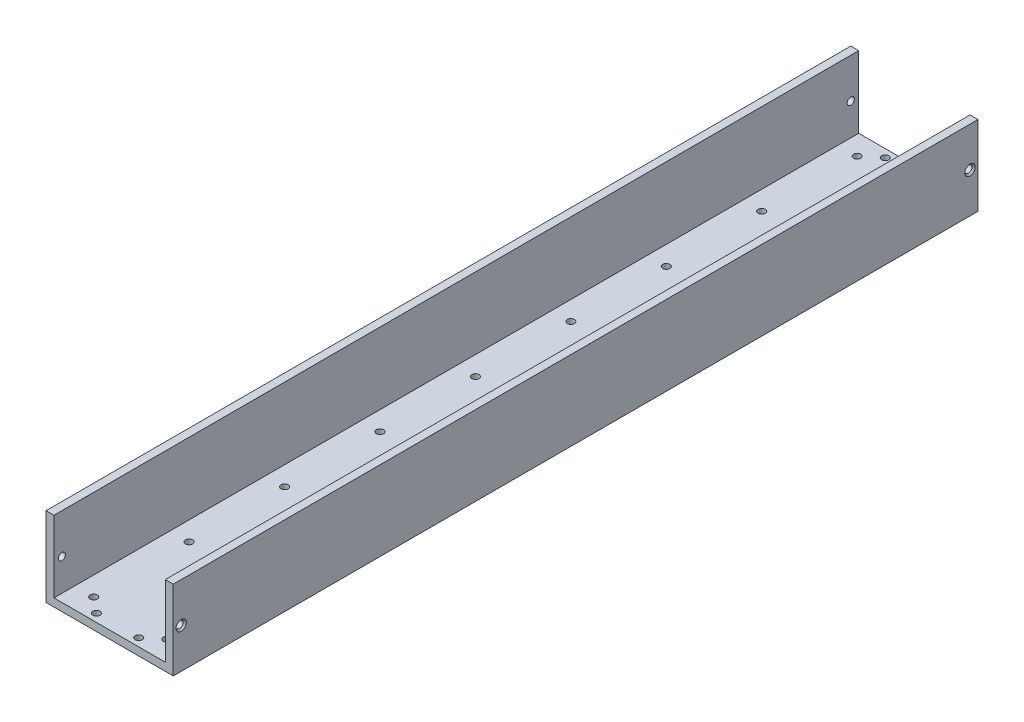
from build123d import *

# Parameters (mm, degrees)
ESTRUSIONE_ESTRUSIONE1_DEPTH = 506
SCHIZZO3_R                   = 2.25
TAGLIO_ESTRUSIONE1_DEPTH     = 515.719341001
SMUSSO1_SIZE                 = 1
SCHIZZO4_R                   = 2.25
TAGLIO_ESTRUSIONE2_DEPTH     = 515.719341001
SCHIZZO5_R                   = 2.25
TAGLIO_ESTRUSIONE3_DEPTH     = 515.719341001
SMUSSO2_SIZE                 = 1


with BuildPart() as part:
    # Schizzo1 → Estrusione-Estrusione1 (new body)
    with BuildSketch(Plane.XY):
        Polygon((75, 5), (75, 50), (80, 50), (80, 0), (0, 0), (0, 50), (5, 50), (5, 5), align=None)
    extrude(amount=-ESTRUSIONE_ESTRUSIONE1_DEPTH)

    # Schizzo3 → Taglio-Estrusione1 (cut, through all)
    with BuildSketch(Plane(origin=(80, 0, 0), x_dir=(0, 0, -1), z_dir=(1, 0, 0))):
        with Locations((5, 25)):
            Circle(SCHIZZO3_R)
        with Locations((501, 25)):
            Circle(SCHIZZO3_R)
    extrude(amount=-TAGLIO_ESTRUSIONE1_DEPTH, mode=Mode.SUBTRACT)

    # Smusso1
    smusso1_edges = [part.edges().sort_by_distance(p)[0] for p in [
        (0, 25, -498.75),
        (0, 25, -2.75),
        (80, 25, -498.75),
        (80, 25, -2.75),
    ]]
    chamfer(smusso1_edges, length=SMUSSO1_SIZE)

    # Schizzo4 → Taglio-Estrusione2 (cut, through all)
    with BuildSketch(Plane.XZ):
        with Locations((63, -253)):
            Circle(SCHIZZO4_R)
        with Locations((63, -193)):
            Circle(SCHIZZO4_R)
        with Locations((63, -133)):
            Circle(SCHIZZO4_R)
        with Locations((63, -73)):
            Circle(SCHIZZO4_R)
        with Locations((63, -13)):
            Circle(SCHIZZO4_R)
        with Locations((63, -493)):
            Circle(SCHIZZO4_R)
        with Locations((63, -433)):
            Circle(SCHIZZO4_R)
        with Locations((63, -373)):
            Circle(SCHIZZO4_R)
        with Locations((63, -313)):
            Circle(SCHIZZO4_R)
        with Locations((17, -313)):
            Circle(SCHIZZO4_R)
        with Locations((17, -373)):
            Circle(SCHIZZO4_R)
        with Locations((17, -433)):
            Circle(SCHIZZO4_R)
        with Locations((17, -493)):
            Circle(SCHIZZO4_R)
        with Locations((17, -13)):
            Circle(SCHIZZO4_R)
        with Locations((17, -73)):
            Circle(SCHIZZO4_R)
        with Locations((17, -133)):
            Circle(SCHIZZO4_R)
        with Locations((17, -193)):
            Circle(SCHIZZO4_R)
        with Locations((17, -253)):
            Circle(SCHIZZO4_R)
    extrude(amount=-TAGLIO_ESTRUSIONE2_DEPTH, mode=Mode.SUBTRACT)

    # Schizzo5 → Taglio-Estrusione3 (cut, through all)
    with BuildSketch(Plane.XZ):
        with Locations((26.7, -5)):
            Circle(SCHIZZO5_R)
        with Locations((53.3, -5)):
            Circle(SCHIZZO5_R)
        with Locations((53.3, -501)):
            Circle(SCHIZZO5_R)
        with Locations((26.7, -501)):
            Circle(SCHIZZO5_R)
    extrude(amount=-TAGLIO_ESTRUSIONE3_DEPTH, mode=Mode.SUBTRACT)

    # Smusso2
    smusso2_edges = [part.edges().sort_by_distance(p)[0] for p in [
        (51.05, 0, -501),
        (24.45, 0, -501),
        (51.05, 0, -5),
        (24.45, 0, -5),
    ]]
    chamfer(smusso2_edges, length=SMUSSO2_SIZE)


solid = part.part
